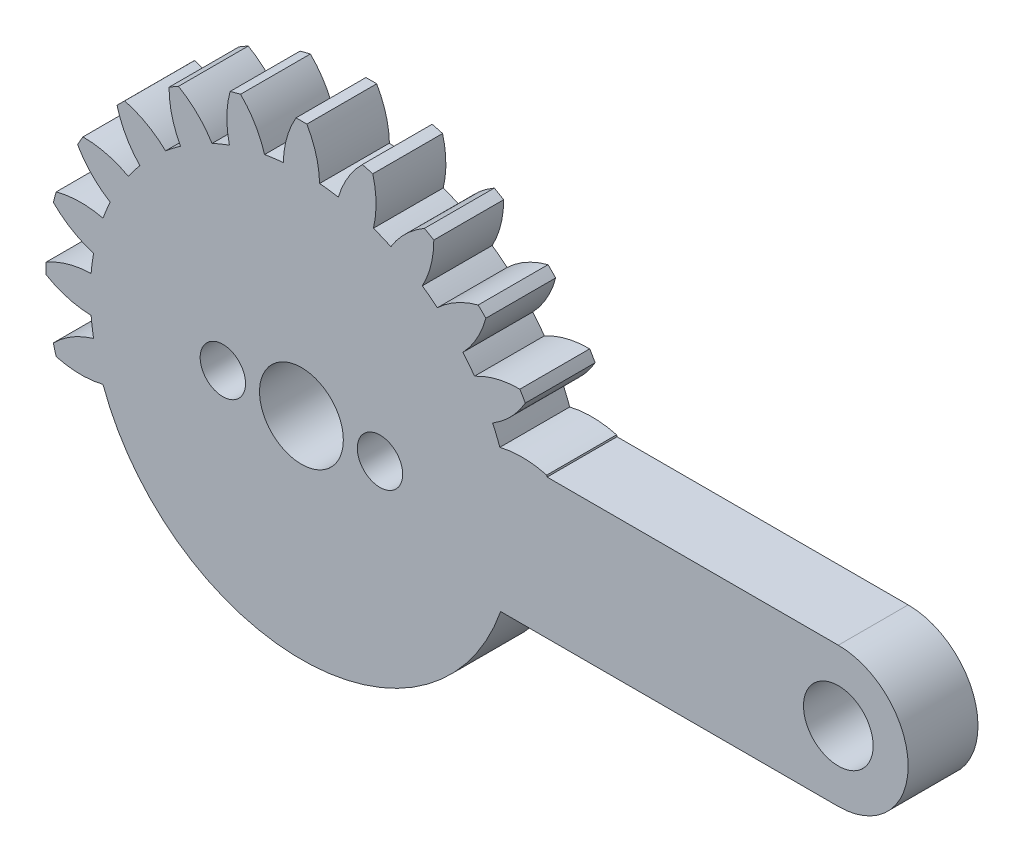
from build123d import *

# Parameters (mm, degrees)
SKETCH2_R           = 1.75
SKETCH2_R_2         = 1.995
BOSS_EXTRUDE1_DEPTH = 4
SKETCH4_R           = 1.3
SKETCH4_R_2         = 2.4
CUT_EXTRUDE1_DEPTH  = 38.915688046


with BuildPart() as part:
    # Sketch2 → Boss-Extrude1 (new body)
    with BuildSketch(Plane.XY):
        with BuildLine():
            ThreePointArc((14.048088143, 4.085109489), (12.709169027, 4.272836063), (11.365584201, 4.122086336))
            ThreePointArc((11.365584201, 4.122086336), (11.169703548, 4.626642697), (10.951436862, 5.12192646))
            ThreePointArc((10.951436862, 5.12192646), (12.008090957, 5.965388247), (12.82210701, 7.044889767))
            ThreePointArc((12.82210701, 7.044889767), (12.669951657, 7.315), (12.51210701, 7.581825517))
            ThreePointArc((12.51210701, 7.581825517), (11.170223244, 7.416617696), (9.911436862, 6.9232593))
            ThreePointArc((9.911436862, 6.9232593), (9.591641884, 7.359925677), (9.252623584, 7.781841479))
            ThreePointArc((9.252623584, 7.781841479), (10.05496909, 8.870045207), (10.561852666, 10.123446462))
            ThreePointArc((10.561852666, 10.123446462), (10.344972209, 10.344972209), (10.123446462, 10.561852666))
            ThreePointArc((10.123446462, 10.561852666), (8.870045207, 10.05496909), (7.781841479, 9.252623584))
            ThreePointArc((7.781841479, 9.252623584), (7.359925677, 9.591641884), (6.9232593, 9.911436862))
            ThreePointArc((6.9232593, 9.911436862), (7.416617696, 11.170223244), (7.581825517, 12.51210701))
            ThreePointArc((7.581825517, 12.51210701), (7.315, 12.669951657), (7.044889767, 12.82210701))
            ThreePointArc((7.044889767, 12.82210701), (5.965388247, 12.008090957), (5.12192646, 10.951436862))
            ThreePointArc((5.12192646, 10.951436862), (4.626642697, 11.169703548), (4.122086336, 11.365584201))
            ThreePointArc((4.122086336, 11.365584201), (4.272836063, 12.709169027), (4.085109489, 14.048088143))
            ThreePointArc((4.085109489, 14.048088143), (3.78652263, 14.131494839), (3.486235477, 14.208555951))
            ThreePointArc((3.486235477, 14.208555951), (2.654199937, 13.14288127), (2.112960617, 11.903927815))
            ThreePointArc((2.112960617, 11.903927815), (1.578061664, 11.986568374), (1.04, 12.04518576))
            ThreePointArc((1.04, 12.04518576), (0.837867713, 13.382005944), (0.31, 14.626715284))
            ThreePointArc((0.31, 14.626715284), (0, 14.63), (-0.31, 14.626715284))
            ThreePointArc((-0.31, 14.626715284), (-0.837867713, 13.382005944), (-1.04, 12.04518576))
            ThreePointArc((-1.04, 12.04518576), (-1.578061664, 11.986568374), (-2.112960617, 11.903927815))
            ThreePointArc((-2.112960617, 11.903927815), (-2.654199937, 13.14288127), (-3.486235477, 14.208555951))
            ThreePointArc((-3.486235477, 14.208555951), (-3.78652263, 14.131494839), (-4.085109489, 14.048088143))
            ThreePointArc((-4.085109489, 14.048088143), (-4.272836063, 12.709169027), (-4.122086336, 11.365584201))
            ThreePointArc((-4.122086336, 11.365584201), (-4.626642697, 11.169703548), (-5.12192646, 10.951436862))
            ThreePointArc((-5.12192646, 10.951436862), (-5.965388247, 12.008090957), (-7.044889767, 12.82210701))
            ThreePointArc((-7.044889767, 12.82210701), (-7.315, 12.669951657), (-7.581825517, 12.51210701))
            ThreePointArc((-7.581825517, 12.51210701), (-7.416617696, 11.170223244), (-6.9232593, 9.911436862))
            ThreePointArc((-6.9232593, 9.911436862), (-7.359925677, 9.591641884), (-7.781841479, 9.252623584))
            ThreePointArc((-7.781841479, 9.252623584), (-8.870045207, 10.05496909), (-10.123446462, 10.561852666))
            ThreePointArc((-10.123446462, 10.561852666), (-10.344972209, 10.344972209), (-10.561852666, 10.123446462))
            ThreePointArc((-10.561852666, 10.123446462), (-10.05496909, 8.870045207), (-9.252623584, 7.781841479))
            ThreePointArc((-9.252623584, 7.781841479), (-9.591641884, 7.359925677), (-9.911436862, 6.9232593))
            ThreePointArc((-9.911436862, 6.9232593), (-11.170223244, 7.416617696), (-12.51210701, 7.581825517))
            ThreePointArc((-12.51210701, 7.581825517), (-12.669951657, 7.315), (-12.82210701, 7.044889767))
            ThreePointArc((-12.82210701, 7.044889767), (-12.008090957, 5.965388247), (-10.951436862, 5.12192646))
            ThreePointArc((-10.951436862, 5.12192646), (-11.169703548, 4.626642697), (-11.365584201, 4.122086336))
            ThreePointArc((-11.365584201, 4.122086336), (-12.709169027, 4.272836063), (-14.048088143, 4.085109489))
            ThreePointArc((-14.048088143, 4.085109489), (-14.131494839, 3.78652263), (-14.208555951, 3.486235477))
            ThreePointArc((-14.208555951, 3.486235477), (-13.14288127, 2.654199937), (-11.903927815, 2.112960617))
            ThreePointArc((-11.903927815, 2.112960617), (-11.986568374, 1.578061664), (-12.04518576, 1.04))
            ThreePointArc((-12.04518576, 1.04), (-13.382005944, 0.837867713), (-14.626715284, 0.31))
            ThreePointArc((-14.626715284, 0.31), (-14.63, 0), (-14.626715284, -0.31))
            ThreePointArc((-14.626715284, -0.31), (-13.382005944, -0.837867713), (-12.04518576, -1.04))
            ThreePointArc((-12.04518576, -1.04), (-11.986568374, -1.578061664), (-11.903927815, -2.112960617))
            ThreePointArc((-11.903927815, -2.112960617), (-13.14288127, -2.654199937), (-14.208555951, -3.486235477))
            ThreePointArc((-14.208555951, -3.486235477), (-14.131494839, -3.78652263), (-14.048088143, -4.085109489))
            ThreePointArc((-14.048088143, -4.085109489), (-12.709169027, -4.272836063), (-11.365584201, -4.122086336))
            ThreePointArc((-11.365584201, -4.122086336), (0.064808849, -12.089826294), (11.409123542, -4))
            Line((11.409123542, -4), (30.75, -4))
            ThreePointArc((30.75, -4), (34.75, 0), (30.75, 4))
            Line((30.75, 4), (14.072558403, 4))
            ThreePointArc((14.072558403, 4), (14.06038767, 4.04257326), (14.048088143, 4.085109489))
        make_face()
        Circle(SKETCH2_R, mode=Mode.SUBTRACT)
        with Locations((30.75, 0)):
            Circle(SKETCH2_R_2, mode=Mode.SUBTRACT)
    extrude(amount=BOSS_EXTRUDE1_DEPTH)

    # Sketch4 → Cut-Extrude1 (cut, through all)
    with BuildSketch(Plane.XY.offset(4)):
        with Locations((4.5, 0)):
            Circle(SKETCH4_R)
        with Locations((-4.5, 0)):
            Circle(SKETCH4_R)
        Circle(SKETCH4_R_2)
    extrude(amount=-CUT_EXTRUDE1_DEPTH, mode=Mode.SUBTRACT)


solid = part.part
